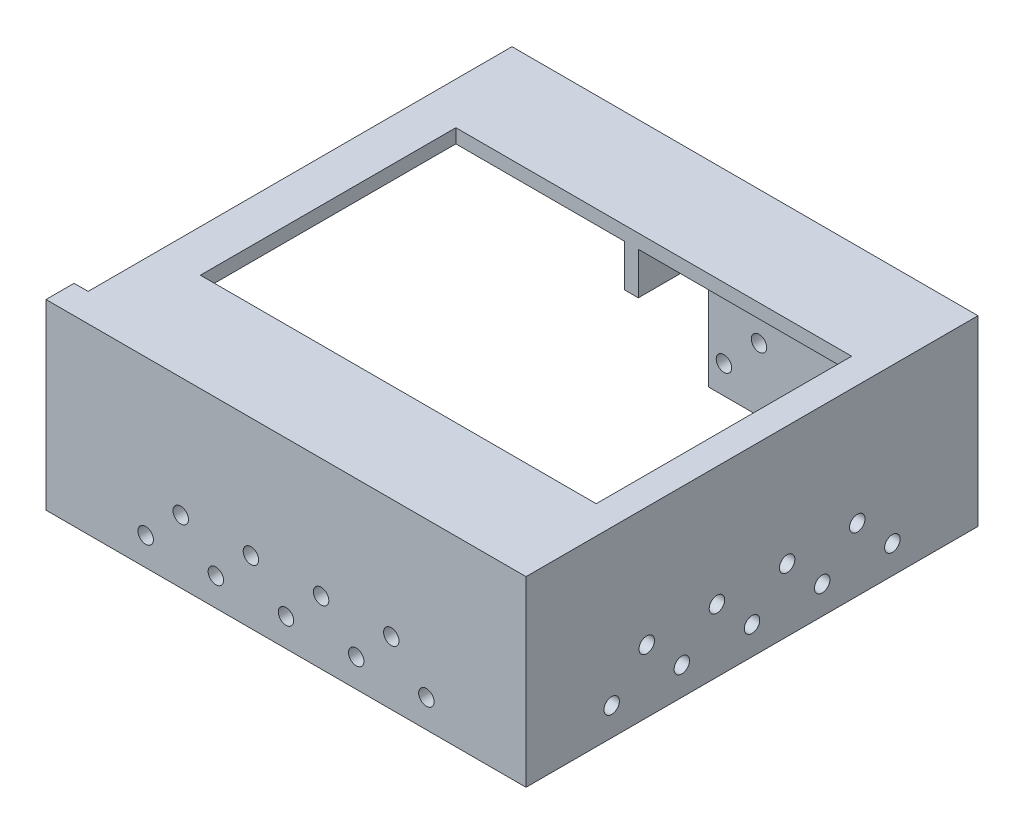
from build123d import *

# Parameters (mm, degrees)
SKETCH1_W                      = 170.999999046
SKETCH1_H                      = 160.999999046
BOSS_EXTRUDE1_DEPTH            = 5
SKETCH2_W                      = 150.999999046
SKETCH2_H                      = 5
CUT_EXTRUDE1_DEPTH             = 5
SKETCH3_W                      = 140.999999046
SKETCH3_H                      = 5
CUT_EXTRUDE2_DEPTH             = 91.000001431
BOSS_EXTRUDE2_DEPTH            = 60
SKETCH5_W                      = 30
SKETCH5_H                      = 45
CUT_EXTRUDE3_DEPTH             = 81.000001431
CUT_EXTRUDE4_REACH             = 159.636
SKETCH7_W                      = 76.000001431
SKETCH7_H                      = 30
SKETCH8_W                      = 115.999999046
SKETCH8_H                      = 60
CUT_EXTRUDE5_DEPTH             = 5
SKETCH9_W                      = 5
SKETCH9_H                      = 30
CUT_EXTRUDE6_DEPTH             = 45
CUT_EXTRUDE7_REACH             = 197.582
SKETCH10_W                     = 155.999999046
SKETCH10_H                     = 60
SKETCH11_W                     = 5
SKETCH11_H                     = 45
CUT_EXTRUDE8_DEPTH             = 5
F_5_5_5_5_DIAMETER_HOLE1_D     = 5.5
F_5_5_5_5_DIAMETER_HOLE2_D     = 5.5
F_5_5_5_5_DIAMETER_HOLE2_DEPTH = 5
F_5_5_5_5_DIAMETER_HOLE3_D     = 5.5
RIB1_START                     = -2.5
RIB1_OUTLINE_W                 = 10
RIB1_OUTLINE_H                 = 15
RIB1_DEPTH                     = 5


# Read off the part's stored shape, not the designer's step: Rib1
with BuildPart() as part:
    # Sketch1 → Boss-Extrude1 (new body)
    with BuildSketch(Plane.XZ):
        with Locations((16.069853306, -24.060089588)):
            Rectangle(SKETCH1_W, SKETCH1_H)
    extrude(amount=-BOSS_EXTRUDE1_DEPTH)

    # Sketch2 → Cut-Extrude1 (cut)
    with BuildSketch(Plane.ZY.offset(69.430146217)):
        with Locations((-29.060089588, 2.5)):
            Rectangle(SKETCH2_W, SKETCH2_H)
    extrude(amount=-CUT_EXTRUDE1_DEPTH, mode=Mode.SUBTRACT)

    # Sketch3 → Cut-Extrude2 (cut)
    with BuildSketch(Plane(origin=(0, 0, -69.560089111), x_dir=(-1, 0, 0), z_dir=(0, 0, -1))):
        with Locations((-21.069853306, 2.5)):
            Rectangle(SKETCH3_W, SKETCH3_H)
    extrude(amount=-CUT_EXTRUDE2_DEPTH, mode=Mode.SUBTRACT)

    # Sketch4 → Boss-Extrude2 (add)
    with BuildSketch(Plane.XZ):
        Polygon((91.569852829, 46.439909935), (-69.430146217, 46.439909935), (-69.430146217, 56.439909935), (101.569852829, 56.439909935), (101.569852829, -104.560089111), (10.569851398, -104.560089111), (10.569851398, -69.560089111), (91.569852829, -69.560089111), align=None)
    extrude(amount=BOSS_EXTRUDE2_DEPTH)

    # Sketch5 → Cut-Extrude3 (cut)
    with BuildSketch(Plane.ZY.offset(-10.569851398)):
        with Locations((-84.560089111, -37.5)):
            Rectangle(SKETCH5_W, SKETCH5_H)
    extrude(amount=-CUT_EXTRUDE3_DEPTH, mode=Mode.SUBTRACT)

    # Sketch7 → Cut-Extrude4 (cut, up to next)
    with BuildSketch(Plane(origin=(0, 0, 0), x_dir=(1, 0, 0), z_dir=(0, 1, 0)), mode=Mode.PRIVATE) as cut_extrude4_sk1:
        with Locations((53.569852114, 84.560089111)):
            Rectangle(SKETCH7_W, SKETCH7_H)
    cut_extrude4_tool1 = extrude(cut_extrude4_sk1.sketch, amount=-CUT_EXTRUDE4_REACH, mode=Mode.PRIVATE) & part.part
    add(cut_extrude4_tool1.solids().sort_by_distance((53.569852, 0, -84.560089))[0], mode=Mode.SUBTRACT)

    # Sketch8 → Cut-Extrude5 (cut)
    with BuildSketch(Plane.ZY.offset(-91.569852829)):
        with Locations((-11.560089588, -30)):
            Rectangle(SKETCH8_W, SKETCH8_H)
    extrude(amount=-CUT_EXTRUDE5_DEPTH, mode=Mode.SUBTRACT)

    # Sketch9 → Cut-Extrude6 (cut)
    with BuildSketch(Plane.XZ.offset(60)):
        with Locations((94.069852829, -84.560089111)):
            Rectangle(SKETCH9_W, SKETCH9_H)
    extrude(amount=-CUT_EXTRUDE6_DEPTH, mode=Mode.SUBTRACT)

    # Sketch10 → Cut-Extrude7 (cut, up to next)
    with BuildSketch(Plane.XY.offset(51.439909935), mode=Mode.PRIVATE) as cut_extrude7_sk1:
        with Locations((18.569853306, -30)):
            Rectangle(SKETCH10_W, SKETCH10_H)
    cut_extrude7_tool1 = extrude(cut_extrude7_sk1.sketch, amount=-CUT_EXTRUDE7_REACH, mode=Mode.PRIVATE) & part.part
    add(cut_extrude7_tool1.solids().sort_by_distance((18.569853, -30, 51.43991))[0], mode=Mode.SUBTRACT)

    # Sketch11 → Cut-Extrude8 (cut)
    with BuildSketch(Plane(origin=(0, 0, 46.439909935), x_dir=(-1, 0, 0), z_dir=(0, 0, -1))):
        with Locations((61.930146217, -37.5)):
            Rectangle(SKETCH11_W, SKETCH11_H)
    extrude(amount=-CUT_EXTRUDE8_DEPTH, mode=Mode.SUBTRACT)

    # Ø5.5 (5.5) Diameter Hole1 (through all)
    with Locations(Plane.ZY.offset(-96.569852829)):
        with Locations((-61.560090383, -37.500000596), (-74.06009078, -50.000000795), (-49.059914748, -50.000000795), (-36.560089588, -37.500000596), (-11.560088396, -37.500000596), (13.439912299, -37.500000596), (0.939911927, -50.000000795), (25.939911604, -50.000000795), (-24.060088595, -50.000000795)):
            Hole(F_5_5_5_5_DIAMETER_HOLE1_D / 2)

    # Ø5.5 (5.5) Diameter Hole2
    with Locations(Plane(origin=(0, 0, 51.439909935), x_dir=(-1, 0, 0), z_dir=(0, 0, -1))):
        with Locations((33.93014888, -50.000000795), (21.430148681, -37.500000596), (8.93014883, -50.000000795), (-3.569851859, -37.500000596), (-16.069851716, -50.000000795), (-28.569851518, -37.500000596), (-41.069852312, -50.000000795), (-53.569852511, -37.500000596), (-66.069851716, -50.000000795)):
            Hole(F_5_5_5_5_DIAMETER_HOLE2_D / 2, depth=F_5_5_5_5_DIAMETER_HOLE2_DEPTH)

    # Ø5.5 (5.5) Diameter Hole3 (through all)
    with Locations(Plane.XY.offset(-99.560089111)):
        with Locations((16.069851716, -50.000000795), (28.569851518, -37.500000596), (41.069852312, -50.000000795), (53.569852511, -37.500000596), (66.069851716, -50.000000795)):
            Hole(F_5_5_5_5_DIAMETER_HOLE3_D / 2)

    # Rib1 outline → Rib1 (add)
    with BuildSketch(Plane(origin=(18.069851398, 0, 0), x_dir=(0, 0, -1), z_dir=(1, 0, 0)).offset(RIB1_START)):
        with Locations((-46.439909935, -7.5)):
            Rectangle(RIB1_OUTLINE_W, RIB1_OUTLINE_H)
    extrude(amount=RIB1_DEPTH)


solid = part.part
